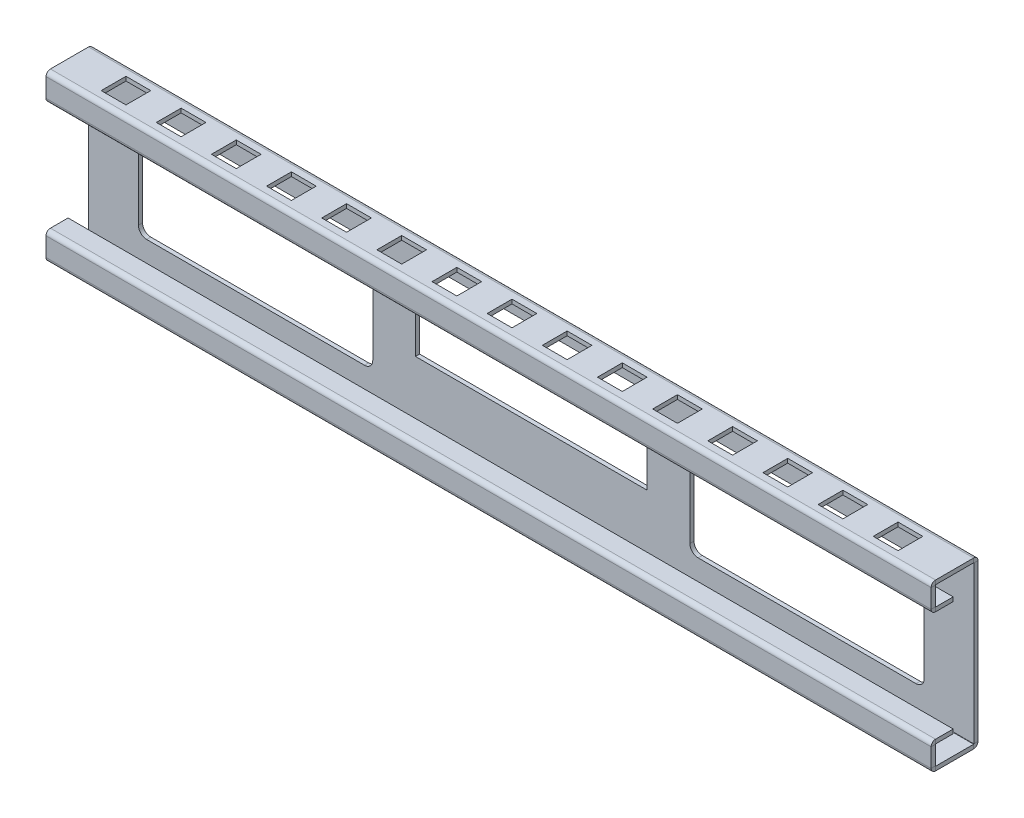
from build123d import *

# Parameters (mm, degrees)
SKETCH_1_W                         = 321
SKETCH_1_H                         = 60
SM_BASE_FLANGE_1_DEPTH             = 1.5
SM_EDGE_FLANGE_1_STRIP_W           = 6.2
SM_EDGE_FLANGE_1_STRIP_H           = 1.5
SM_EDGE_FLANGE_1_STRIP_CUT_DEPTH   = 321
SM_EDGE_FLANGE_1_STRIP_2_W         = 6.2
SM_EDGE_FLANGE_1_STRIP_2_H         = 1.5
SM_EDGE_FLANGE_1_STRIP_CUT_2_DEPTH = 321
SM_EDGE_FLANGE_1_DEPTH             = 321
SM_EDGE_FLANGE_1_BEND_DEPTH        = 321
SM_EDGE_FLANGE_2_STRIP_W           = 6.2
SM_EDGE_FLANGE_2_STRIP_H           = 1.5
SM_EDGE_FLANGE_2_STRIP_CUT_DEPTH   = 321
SM_EDGE_FLANGE_2_STRIP_2_W         = 6.2
SM_EDGE_FLANGE_2_STRIP_2_H         = 1.5
SM_EDGE_FLANGE_2_STRIP_CUT_2_DEPTH = 321
SM_EDGE_FLANGE_2_DEPTH             = 321
SM_EDGE_FLANGE_2_BEND_DEPTH        = 321
CUT_EXTRUDE_1_DEPTH                = 10
PATTERN_LINEAR_1_COUNT             = 2
PATTERN_LINEAR_1_PITCH             = 100
PATTERN_LINEAR_1_COL_COUNT         = 2
PATTERN_LINEAR_1_COL_PITCH         = 100
SKETCH_19_W                        = 9
SKETCH_19_H                        = 9
CUT_EXTRUDE_2_DEPTH                = 173.04795843
PATTERN_LINEAR_2_COUNT             = 8
PATTERN_LINEAR_2_PITCH             = 20
PATTERN_LINEAR_2_COL_COUNT         = 8
PATTERN_LINEAR_2_COL_PITCH         = 20
SM_EDGE_FLANGE_3_STRIP_W           = 6.2
SM_EDGE_FLANGE_3_STRIP_H           = 1.5
SM_EDGE_FLANGE_3_STRIP_CUT_DEPTH   = 321
SM_EDGE_FLANGE_3_STRIP_2_W         = 6.2
SM_EDGE_FLANGE_3_STRIP_2_H         = 1.5
SM_EDGE_FLANGE_3_STRIP_CUT_2_DEPTH = 321
SM_EDGE_FLANGE_3_DEPTH             = 321
SM_EDGE_FLANGE_3_BEND_DEPTH        = 321
EXTRUDE_1_DEPTH                    = 1.5
SKETCH_27_W                        = 84
SKETCH_27_H                        = 31
CUT_EXTRUDE_3_DEPTH                = 6


# Sheet-metal steps are written as plain solids
with BuildPart() as part:
    # Sketch 1 → 基体-法兰1 (new body)
    with BuildSketch(Plane.XY):
        Rectangle(SKETCH_1_W, SKETCH_1_H)
    extrude(amount=-SM_BASE_FLANGE_1_DEPTH)

    # 边线-法兰1 strip (across the edge) → 边线-法兰1 strip cut (cut)
    with BuildSketch(Plane(origin=(160.5, 30, 0), x_dir=(0, -1, 0), z_dir=(-1, 0, 0))):
        with Locations((-1.5, -0.75)):
            Rectangle(SM_EDGE_FLANGE_1_STRIP_W, SM_EDGE_FLANGE_1_STRIP_H)
    extrude(amount=SM_EDGE_FLANGE_1_STRIP_CUT_DEPTH, mode=Mode.SUBTRACT)

    # 边线-法兰1 strip 2 (across the edge) → 边线-法兰1 strip cut 2 (cut)
    with BuildSketch(Plane(origin=(-160.5, -30, 0), x_dir=(0, 1, 0), z_dir=(1, 0, 0))):
        with Locations((-1.5, -0.75)):
            Rectangle(SM_EDGE_FLANGE_1_STRIP_2_W, SM_EDGE_FLANGE_1_STRIP_2_H)
    extrude(amount=SM_EDGE_FLANGE_1_STRIP_CUT_2_DEPTH, mode=Mode.SUBTRACT)

    # 边线-法兰1 section (across the edge) → 边线-法兰1 (add)
    with BuildSketch(Plane(origin=(160.5, 30, 0), x_dir=(0, -1, 0), z_dir=(-1, 0, 0))):
        with BuildLine():
            Line((0, 0.1), (0, 15.5))
            Line((0, 15.5), (1.5, 15.5))
            Line((1.5, 15.5), (1.5, 0.1))
            ThreePointArc((1.5, 0.1), (1.529289322, 0.029289322), (1.6, 0))
            Line((1.6, 0), (1.6, -1.5))
            ThreePointArc((1.6, -1.5), (0.46862915, -1.03137085), (0, 0.1))
        make_face()
    extrude(amount=SM_EDGE_FLANGE_1_DEPTH)

    # 边线-法兰1 section 2 (across the edge) → 边线-法兰1 bend (add)
    with BuildSketch(Plane(origin=(-160.5, -30, 0), x_dir=(0, 1, 0), z_dir=(1, 0, 0))):
        with BuildLine():
            Line((0, 0.1), (0, 15.5))
            Line((0, 15.5), (1.5, 15.5))
            Line((1.5, 15.5), (1.5, 0.1))
            ThreePointArc((1.5, 0.1), (1.529289322, 0.029289322), (1.6, 0))
            Line((1.6, 0), (1.6, -1.5))
            ThreePointArc((1.6, -1.5), (0.46862915, -1.03137085), (0, 0.1))
        make_face()
    extrude(amount=SM_EDGE_FLANGE_1_BEND_DEPTH)

    # 边线-法兰2 strip (across the edge) → 边线-法兰2 strip cut (cut)
    with BuildSketch(Plane(origin=(160.5, 28.5, 15.5), x_dir=(0, 0, -1), z_dir=(-1, 0, 0))):
        with Locations((-1.5, -0.75)):
            Rectangle(SM_EDGE_FLANGE_2_STRIP_W, SM_EDGE_FLANGE_2_STRIP_H)
    extrude(amount=SM_EDGE_FLANGE_2_STRIP_CUT_DEPTH, mode=Mode.SUBTRACT)

    # 边线-法兰2 strip 2 (across the edge) → 边线-法兰2 strip cut 2 (cut)
    with BuildSketch(Plane(origin=(-160.5, -28.5, 15.5), x_dir=(0, 0, -1), z_dir=(1, 0, 0))):
        with Locations((-1.5, -0.75)):
            Rectangle(SM_EDGE_FLANGE_2_STRIP_2_W, SM_EDGE_FLANGE_2_STRIP_2_H)
    extrude(amount=SM_EDGE_FLANGE_2_STRIP_CUT_2_DEPTH, mode=Mode.SUBTRACT)

    # 边线-法兰2 section (across the edge) → 边线-法兰2 (add)
    with BuildSketch(Plane(origin=(160.5, 28.5, 15.5), x_dir=(0, 0, -1), z_dir=(-1, 0, 0))):
        with BuildLine():
            Line((0, 0.1), (0, 8.5))
            Line((0, 8.5), (1.5, 8.5))
            Line((1.5, 8.5), (1.5, 0.1))
            ThreePointArc((1.5, 0.1), (1.529289322, 0.029289322), (1.6, 0))
            Line((1.6, 0), (1.6, -1.5))
            ThreePointArc((1.6, -1.5), (0.46862915, -1.03137085), (0, 0.1))
        make_face()
    extrude(amount=SM_EDGE_FLANGE_2_DEPTH)

    # 边线-法兰2 section 2 (across the edge) → 边线-法兰2 bend (add)
    with BuildSketch(Plane(origin=(-160.5, -28.5, 15.5), x_dir=(0, 0, -1), z_dir=(1, 0, 0))):
        with BuildLine():
            Line((0, 0.1), (0, 8.5))
            Line((0, 8.5), (1.5, 8.5))
            Line((1.5, 8.5), (1.5, 0.1))
            ThreePointArc((1.5, 0.1), (1.529289322, 0.029289322), (1.6, 0))
            Line((1.6, 0), (1.6, -1.5))
            ThreePointArc((1.6, -1.5), (0.46862915, -1.03137085), (0, 0.1))
        make_face()
    extrude(amount=SM_EDGE_FLANGE_2_BEND_DEPTH)

    # 草图18 → 切除-拉伸1 (cut)
    with BuildSketch(Plane(origin=(0, 0, -1.5), x_dir=(-1, 0, 0), z_dir=(0, 0, -1))):
        with BuildLine():
            Line((-39.5, 20), (39.5, 20))
            ThreePointArc((39.5, 20), (41.621320344, 19.121320344), (42.5, 17))
            Line((42.5, 17), (42.5, -17))
            ThreePointArc((42.5, -17), (41.621320344, -19.121320344), (39.5, -20))
            Line((39.5, -20), (-39.5, -20))
            ThreePointArc((-39.5, -20), (-41.621320344, -19.121320344), (-42.5, -17))
            Line((-42.5, -17), (-42.5, 17))
            ThreePointArc((-42.5, 17), (-41.621320344, 19.121320344), (-39.5, 20))
        make_face()
    cut_extrude_1 = extrude(amount=-CUT_EXTRUDE_1_DEPTH, mode=Mode.SUBTRACT)

    # 阵列(线性)1: 切除-拉伸1 ×2
    with Locations(*[(-i * PATTERN_LINEAR_1_PITCH, 0, 0) for i in range(1, PATTERN_LINEAR_1_COUNT)]):
        add(cut_extrude_1, mode=Mode.SUBTRACT)

    # 阵列(线性)1 col: 切除-拉伸1 ×2
    with Locations(*[(i * PATTERN_LINEAR_1_COL_PITCH, 0, 0) for i in range(1, PATTERN_LINEAR_1_COL_COUNT)]):
        add(cut_extrude_1, mode=Mode.SUBTRACT)

    # 草图19 → 切除-拉伸2 (cut, through all)
    with BuildSketch(Plane(origin=(0, 30, 0), x_dir=(1, 0, 0), z_dir=(0, 1, 0))):
        with Locations((0, -7)):
            Rectangle(SKETCH_19_W, SKETCH_19_H)
    cut_extrude_2 = extrude(amount=-CUT_EXTRUDE_2_DEPTH, mode=Mode.SUBTRACT)

    # 阵列(线性)2: 切除-拉伸2 ×8
    with Locations(*[(-i * PATTERN_LINEAR_2_PITCH, 0, 0) for i in range(1, PATTERN_LINEAR_2_COUNT)]):
        add(cut_extrude_2, mode=Mode.SUBTRACT)

    # 阵列(线性)2 col: 切除-拉伸2 ×8
    with Locations(*[(i * PATTERN_LINEAR_2_COL_PITCH, 0, 0) for i in range(1, PATTERN_LINEAR_2_COL_COUNT)]):
        add(cut_extrude_2, mode=Mode.SUBTRACT)

    # 边线-法兰3 strip (across the edge) → 边线-法兰3 strip cut (cut)
    with BuildSketch(Plane(origin=(-160.5, -20, 14), x_dir=(0, -1, 0), z_dir=(1, 0, 0))):
        with Locations((-1.5, -0.75)):
            Rectangle(SM_EDGE_FLANGE_3_STRIP_W, SM_EDGE_FLANGE_3_STRIP_H)
    extrude(amount=SM_EDGE_FLANGE_3_STRIP_CUT_DEPTH, mode=Mode.SUBTRACT)

    # 边线-法兰3 strip 2 (across the edge) → 边线-法兰3 strip cut 2 (cut)
    with BuildSketch(Plane(origin=(160.5, 20, 14), x_dir=(0, 1, 0), z_dir=(-1, 0, 0))):
        with Locations((-1.5, -0.75)):
            Rectangle(SM_EDGE_FLANGE_3_STRIP_2_W, SM_EDGE_FLANGE_3_STRIP_2_H)
    extrude(amount=SM_EDGE_FLANGE_3_STRIP_CUT_2_DEPTH, mode=Mode.SUBTRACT)

    # 边线-法兰3 section (across the edge) → 边线-法兰3 (add)
    with BuildSketch(Plane(origin=(-160.5, -20, 14), x_dir=(0, -1, 0), z_dir=(1, 0, 0))):
        with BuildLine():
            Line((0, 0.1), (0, 6.5))
            Line((0, 6.5), (1.5, 6.5))
            Line((1.5, 6.5), (1.5, 0.1))
            ThreePointArc((1.5, 0.1), (1.529289322, 0.029289322), (1.6, 0))
            Line((1.6, 0), (1.6, -1.5))
            ThreePointArc((1.6, -1.5), (0.46862915, -1.03137085), (0, 0.1))
        make_face()
    extrude(amount=SM_EDGE_FLANGE_3_DEPTH)

    # 边线-法兰3 section 2 (across the edge) → 边线-法兰3 bend (add)
    with BuildSketch(Plane(origin=(160.5, 20, 14), x_dir=(0, 1, 0), z_dir=(-1, 0, 0))):
        with BuildLine():
            Line((0, 0.1), (0, 6.5))
            Line((0, 6.5), (1.5, 6.5))
            Line((1.5, 6.5), (1.5, 0.1))
            ThreePointArc((1.5, 0.1), (1.529289322, 0.029289322), (1.6, 0))
            Line((1.6, 0), (1.6, -1.5))
            ThreePointArc((1.6, -1.5), (0.46862915, -1.03137085), (0, 0.1))
        make_face()
    extrude(amount=SM_EDGE_FLANGE_3_BEND_DEPTH)

    # 草图26 → 凸台-拉伸1 (add)
    with BuildSketch(Plane(origin=(0, 0, -1.5), x_dir=(-1, 0, 0), z_dir=(0, 0, -1))):
        with BuildLine():
            Line((42.5, -17), (42.5, 17))
            ThreePointArc((42.5, 17), (41.621320344, 19.121320344), (39.5, 20))
            Line((39.5, 20), (-39.5, 20))
            ThreePointArc((-39.5, 20), (-41.621320344, 19.121320344), (-42.5, 17))
            Line((-42.5, 17), (-42.5, -17))
            ThreePointArc((-42.5, -17), (-41.621320344, -19.121320344), (-39.5, -20))
            Line((-39.5, -20), (39.5, -20))
            ThreePointArc((39.5, -20), (41.621320344, -19.121320344), (42.5, -17))
        make_face()
    extrude(amount=-EXTRUDE_1_DEPTH)

    # 草图27 → 切除-拉伸3 (cut)
    with BuildSketch(Plane(origin=(0, 0, -1.5), x_dir=(-1, 0, 0), z_dir=(0, 0, -1))):
        with Locations((0, 7.5)):
            Rectangle(SKETCH_27_W, SKETCH_27_H)
    extrude(amount=-CUT_EXTRUDE_3_DEPTH, mode=Mode.SUBTRACT)


solid = part.part
